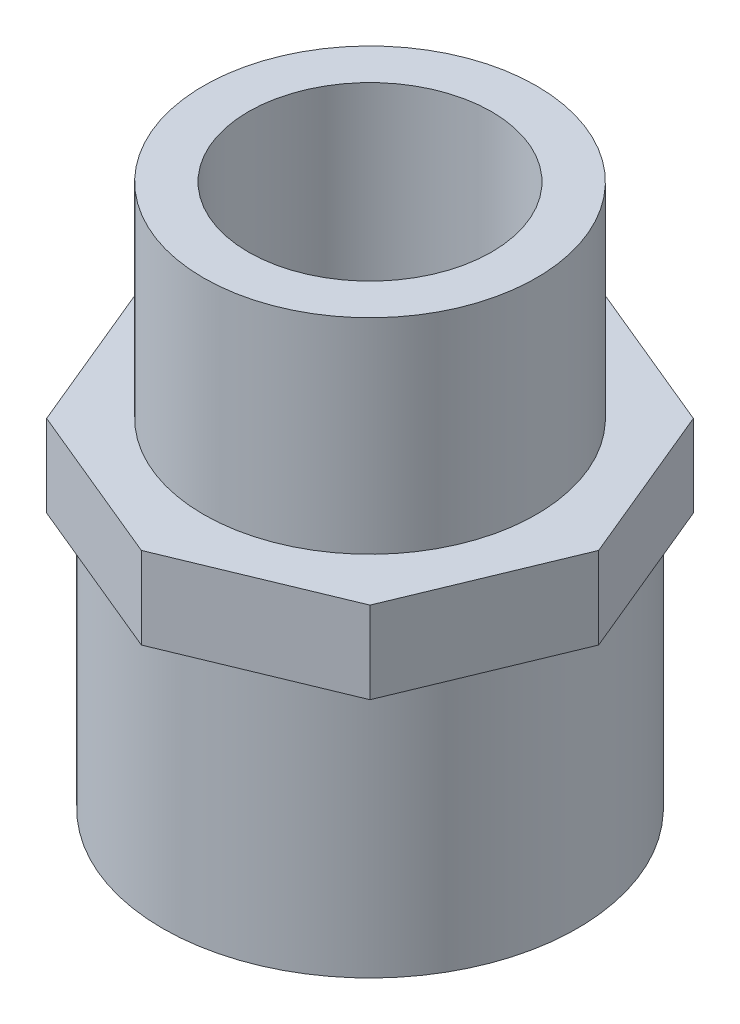
from build123d import *

# Parameters (mm, degrees)
SKETCH1_R           = 12.065
BOSS_EXTRUDE1_DEPTH = 8.128
SKETCH2_R           = 20.574
SKETCH2_R_2         = 16.637
BOSS_EXTRUDE2_DEPTH = 25.4
SKETCH3_R           = 16.51
SKETCH3_R_2         = 12.065
BOSS_EXTRUDE3_DEPTH = 20.32


with BuildPart() as part:
    # Sketch1 → Boss-Extrude1 (new body)
    with BuildSketch(Plane(origin=(0, 0, 0), x_dir=(1, 0, 0), z_dir=(0, 1, 0))):
        Polygon((22.681528557, 0), (16.03826265, 16.03826265), (0, 22.681528557), (-16.03826265, 16.03826265), (-22.681528557, 0), (-16.03826265, -16.03826265), (0, -22.681528557), (16.03826265, -16.03826265), align=None)
        Circle(SKETCH1_R, mode=Mode.SUBTRACT)
    extrude(amount=BOSS_EXTRUDE1_DEPTH)

    # Sketch2 → Boss-Extrude2 (add)
    with BuildSketch(Plane.XZ):
        Circle(SKETCH2_R)
        Circle(SKETCH2_R_2, mode=Mode.SUBTRACT)
    extrude(amount=BOSS_EXTRUDE2_DEPTH)

    # Sketch3 → Boss-Extrude3 (add)
    with BuildSketch(Plane(origin=(0, 8.128, 0), x_dir=(1, 0, 0), z_dir=(0, 1, 0))):
        Circle(SKETCH3_R)
        Circle(SKETCH3_R_2, mode=Mode.SUBTRACT)
    extrude(amount=BOSS_EXTRUDE3_DEPTH)


solid = part.part
